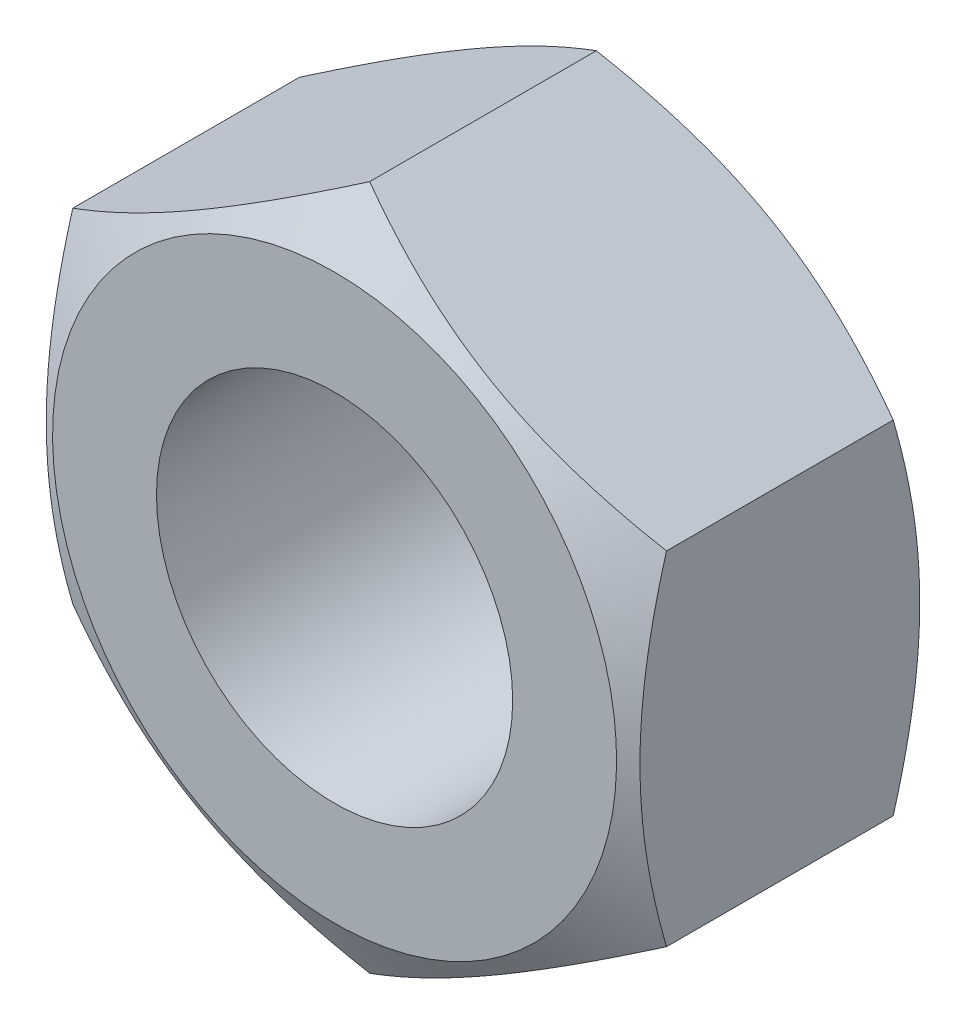
from build123d import *

# Parameters (mm, degrees)
SKETCH_1_R      = 0.6
EXTRUDE_1_DEPTH = 1


with BuildPart() as part:
    # Эскиз1 → Бобышка-Вытянуть1 (new body)
    with BuildSketch(Plane.XY):
        Polygon((0, 1.154700538), (-1, 0.577350269), (-1, -0.577350269), (0, -1.154700538), (1, -0.577350269), (1, 0.577350269), align=None)
        Circle(SKETCH_1_R, mode=Mode.SUBTRACT)
    extrude(amount=EXTRUDE_1_DEPTH)

    # Эскиз2 → Вырез-Повернуть1 (revolve, cut)
    with BuildSketch(Plane(origin=(0, 0, 0), x_dir=(0, 0, -1), z_dir=(1, 0, 0))):
        Polygon((-0.218976383, 1.329278221), (0, 0.95), (0, 1.329278221), align=None)
        Polygon((-0.781023617, 1.329278221), (-1, 1.329278221), (-1, 0.95), align=None)
    revolve(axis=Axis((0, 0, 0), (0, 0, 1)), mode=Mode.SUBTRACT)


solid = part.part
